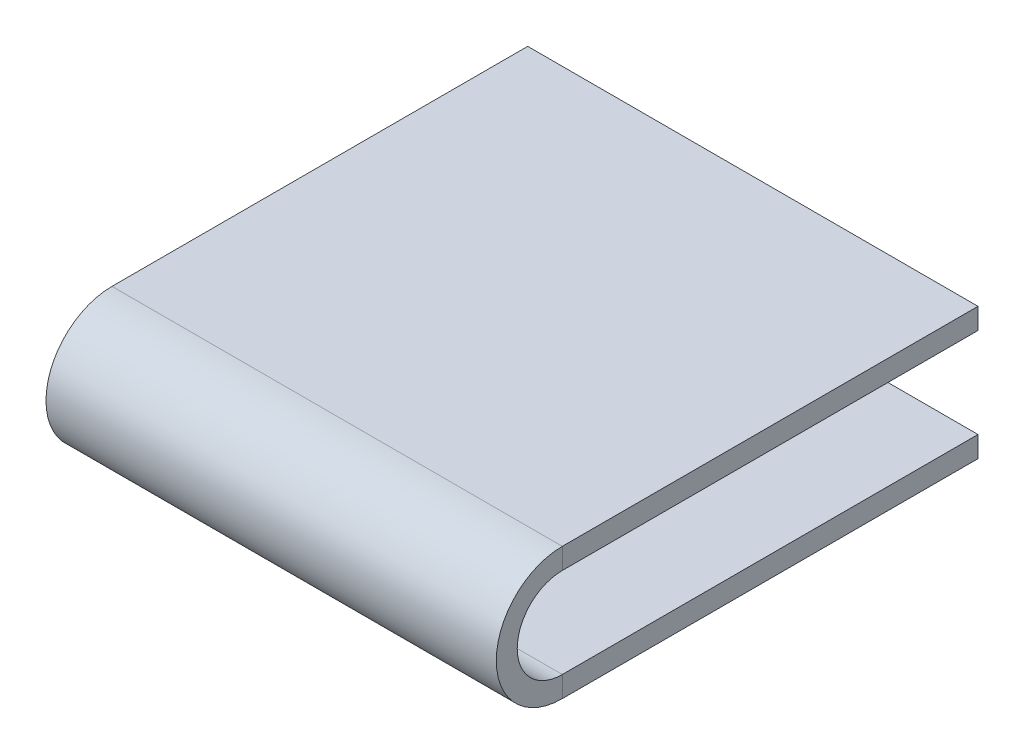
from build123d import *

# Parameters (mm, degrees)
TABAN_FLAN_1_DEPTH = 21.5


# Sheet-metal steps are written as plain solids
with BuildPart() as part:
    # Çizim1 → Taban-Flanş1 (new body)
    with BuildSketch(Plane.YZ):
        with BuildLine():
            Line((0, 0), (0, 19.85))
            ThreePointArc((0, 19.85), (2.15, 22), (4.3, 19.85))
            Line((4.3, 19.85), (4.3, 0))
            Line((4.3, 0), (5.3, 0))
            Line((5.3, 0), (5.3, 19.85))
            ThreePointArc((5.3, 19.85), (2.15, 23), (-1, 19.85))
            Line((-1, 19.85), (-1, 0))
            Line((-1, 0), (0, 0))
        make_face()
    extrude(amount=TABAN_FLAN_1_DEPTH)


solid = part.part
